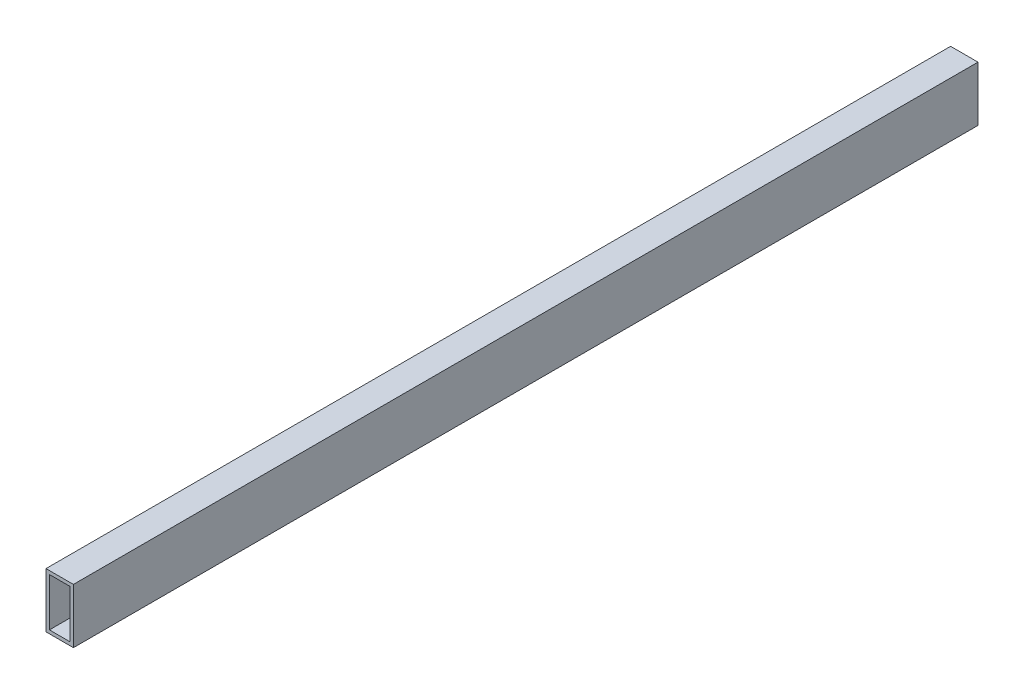
from build123d import *

# Parameters (mm, degrees)
SKETCH1_W           = 25.4
SKETCH1_H           = 50.8
SKETCH1_W_2         = 19.05
SKETCH1_H_2         = 44.45
BOSS_EXTRUDE1_DEPTH = 838.2


with BuildPart() as part:
    # Sketch1 → Boss-Extrude1 (new body)
    with BuildSketch(Plane.XY):
        Rectangle(SKETCH1_W, SKETCH1_H)
        Rectangle(SKETCH1_W_2, SKETCH1_H_2, mode=Mode.SUBTRACT)
    extrude(amount=BOSS_EXTRUDE1_DEPTH)


solid = part.part
